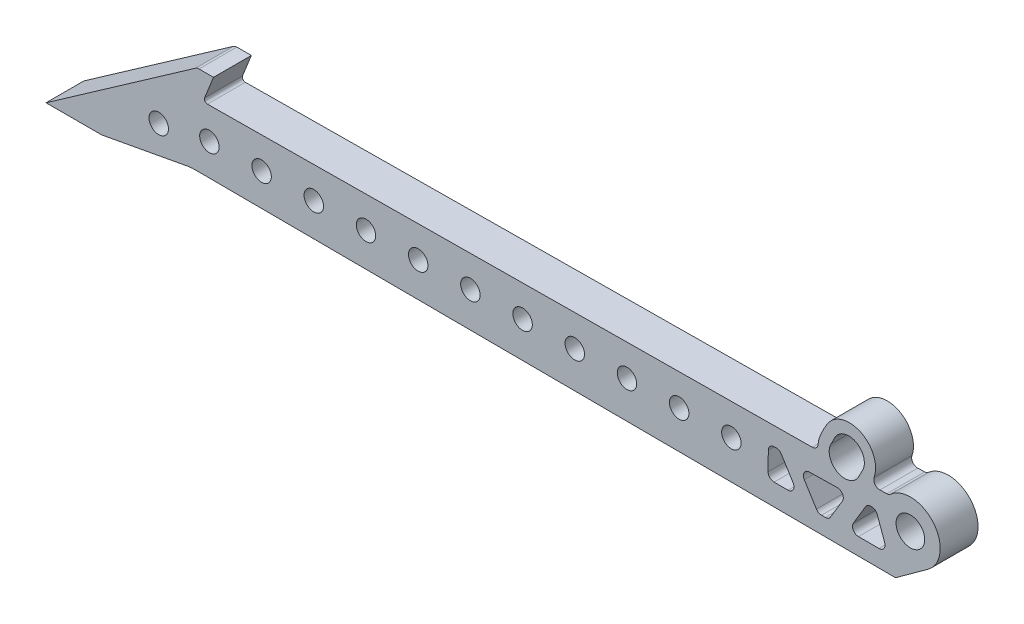
from build123d import *

# Parameters (mm, degrees)
SKETCH1_R           = 3.2639
SKETCH1_R_2         = 4.8025
BOSS_EXTRUDE1_DEPTH = 12.7
EXTRUDE_THIN1_DEPTH = 12.7
FILLET6_R           = 2
FILLET3_R           = 1
FILLET4_R           = 2
BOSS_EXTRUDE5_DEPTH = 12.7
CUT_EXTRUDE8_DEPTH  = 12.7
FILLET13_R          = 100
FILLET14_R          = 2
CUT_EXTRUDE9_DEPTH  = 12.7
FILLET16_R          = 2
BOSS_EXTRUDE6_DEPTH = 12.7
SKETCH18_R          = 3.2639
CUT_EXTRUDE10_DEPTH = 12.7
FILLET17_R          = 2
CUT_EXTRUDE11_DEPTH = 12.7
BOSS_EXTRUDE7_START = -12.7
BOSS_EXTRUDE7_DEPTH = 12.7
DELETEFACE1_DEPTH   = 12.7
MOVE_FACE1_DEPTH    = 12.7
MOVE_FACE1_2_DEPTH  = 12.7
MOVE_FACE2_DEPTH    = 12.7
MOVE_FACE2_2_DEPTH  = 12.7
SKETCH27_R          = 3.2639
CUT_EXTRUDE12_DEPTH = 12.7
FILLET18_R          = 15
FILLET19_R          = 1
FILLET20_R          = 2
MOVE_FACE3_DEPTH    = 12.7
MOVE_FACE3_2_DEPTH  = 12.7
FILLET21_R          = 2


# Read off the part's stored shape, not the designer's step: DeleteFace1, Move Face1, Move Face2, Move Face3
with BuildPart() as part:
    # Sketch1 → Boss-Extrude1 (new body)
    with BuildSketch(Plane.XY):
        with BuildLine():
            Line((-266.801436578, 66.762186411), (-251.101436578, 66.762186411))
            Line((-251.101436578, 66.762186411), (-241.101436578, 68.762186411))
            Line((-241.101436578, 68.762186411), (18.198563422, 71.262186411))
            Line((18.198563422, 71.262186411), (29.067448443, 79.140508783))
            ThreePointArc((29.067448443, 79.140508783), (30.773671377, 93.765412775), (16.057134994, 94.237186411))
            Line((16.057134994, 94.237186411), (-218.528848369, 87.762186411))
            Line((-218.528848369, 87.762186411), (-214.528848369, 97.762186411))
            Line((-214.528848369, 97.762186411), (-222.528848369, 97.762186411))
            Line((-222.528848369, 97.762186411), (-266.801436578, 66.762186411))
        make_face()
        with Locations((-211.801436578, 78.496276476)):
            Circle(SKETCH1_R, mode=Mode.SUBTRACT)
        with BuildLine():
            ThreePointArc((-197.554771535, 78.761405302), (-194.352166872, 82.085470554), (-191.028101621, 78.882865891))
            ThreePointArc((-191.028101621, 78.882865891), (-194.230706283, 75.55880064), (-197.554771535, 78.761405302))
        make_face(mode=Mode.SUBTRACT)
        with BuildLine():
            ThreePointArc((-180.044771535, 79.087264423), (-176.842166872, 82.411329675), (-173.518101621, 79.208725013))
            ThreePointArc((-173.518101621, 79.208725013), (-176.720706283, 75.884659761), (-180.044771535, 79.087264423))
        make_face(mode=Mode.SUBTRACT)
        with BuildLine():
            ThreePointArc((-162.534771535, 79.413123544), (-159.332166872, 82.737188796), (-156.008101621, 79.534584134))
            ThreePointArc((-156.008101621, 79.534584134), (-159.210706283, 76.210518882), (-162.534771535, 79.413123544))
        make_face(mode=Mode.SUBTRACT)
        with BuildLine():
            ThreePointArc((-145.024771535, 79.738982665), (-141.822166872, 83.063047917), (-138.498101621, 79.860443255))
            ThreePointArc((-138.498101621, 79.860443255), (-141.700706283, 76.536378003), (-145.024771535, 79.738982665))
        make_face(mode=Mode.SUBTRACT)
        with Locations((-124.251436578, 80.125572081)):
            Circle(SKETCH1_R, mode=Mode.SUBTRACT)
        with Locations((-106.744467891, 80.45137479)):
            Circle(SKETCH1_R, mode=Mode.SUBTRACT)
        with Locations((-89.237499204, 80.777177499)):
            Circle(SKETCH1_R, mode=Mode.SUBTRACT)
        with Locations((-71.727499204, 81.10303662)):
            Circle(SKETCH1_R, mode=Mode.SUBTRACT)
        with BuildLine():
            ThreePointArc((-56.754762895, 76.539814612), (-61.641816892, 81.290680691), (-56.935012167, 86.220185184))
            Line((-56.935012167, 86.220185184), (11.656299, 88.113430183))
            Line((11.656299, 88.113430183), (15.733532107, 77.238699061))
            Line((15.733532107, 77.238699061), (-56.754762895, 76.539814612))
        make_face(mode=Mode.SUBTRACT)
        with Locations((23.198563422, 87.237186411)):
            Circle(SKETCH1_R_2, mode=Mode.SUBTRACT)
    extrude(amount=BOSS_EXTRUDE1_DEPTH)

    # Sketch3 → Extrude-Thin1 (add)
    with BuildSketch(Plane.XY.offset(12.7)):
        Polygon((4.238515695, 91.06458037), (3.224088624, 89.340939538), (-3.171442721, 78.474116994), (-4.185869793, 76.750476162), (0.554142495, 73.960801716), (1.568569566, 75.684442548), (7.964100911, 86.551265092), (8.978527982, 88.274905924), align=None)
        Polygon((-7.406763076, 76.778305642), (-8.483669151, 78.463616684), (-15.08355213, 88.792145717), (-16.160458205, 90.477456759), (-20.795063569, 87.515965054), (-19.718157494, 85.830654012), (-13.118274515, 75.502124979), (-12.04136844, 73.816813937), align=None)
        Polygon((-55.789995158, 86.920345113), (-54.713089083, 85.235034072), (-48.113206103, 74.906505038), (-47.036300029, 73.221193997), (-42.401694665, 76.182685702), (-43.478600739, 77.867996743), (-50.078483719, 88.196525777), (-51.155389794, 89.881836818), align=None)
        Polygon((-30.756415894, 90.46896043), (-31.770842965, 88.745319598), (-38.16637431, 77.878497054), (-39.180801381, 76.154856222), (-34.440789094, 73.365181776), (-33.426362022, 75.088822608), (-27.030830678, 85.955645152), (-26.016403606, 87.679285984), align=None)
    extrude(amount=-EXTRUDE_THIN1_DEPTH)

    # Fillet6
    fillet6_edges = [part.edges().sort_by_distance(p)[0] for p in [
        (-7.55746183, 77.014142621, 6.35),
        (-14.193924314, 87.399916982, 6.35),
        (-38.852657232, 76.712414937, 6.35),
        (-32.865984778, 86.884534137, 6.35),
        (-32.434398171, 76.774295568, 6.35),
        (-26.378761772, 87.063593296, 6.35),
        (-49.203405679, 76.61261983, 6.35),
        (-55.370195509, 86.263376972, 6.35),
        (-42.716385675, 76.675163409, 6.35),
        (-48.956334512, 86.440411206, 6.35),
        (15.733532107, 77.238699061, 6.35),
        (11.656299, 88.113430183, 6.35),
        (-4.010566108, 77.048339456, 6.35),
        (2.350483264, 87.856572736, 6.35),
        (2.407692953, 77.110220087, 6.35),
        (8.83770627, 88.035631895, 6.35),
    ]]
    fillet(fillet6_edges, radius=FILLET6_R)

    # Fillet3
    fillet3_edges = [part.edges().sort_by_distance(p)[0] for p in [
        (-218.528848369, 87.762186411, 6.35),
    ]]
    fillet(fillet3_edges, radius=FILLET3_R)

    # Fillet4
    fillet4_edges = [part.edges().sort_by_distance(p)[0] for p in [
        (-222.528848369, 97.762186411, 6.35),
    ]]
    fillet(fillet4_edges, radius=FILLET4_R)

    # Sketch15 → Boss-Extrude5 (add)
    with BuildSketch(Plane(origin=(0, 0, 0), x_dir=(-1, 0, 0), z_dir=(0, 0, -1))):
        with BuildLine():
            ThreePointArc((-10.240564525, 95.177858348), (-9.91771052, 94.625214052), (-9.618412164, 94.059465945))
            Line((-9.618412164, 94.059465945), (-5.586658581, 93.948182209))
            ThreePointArc((-5.586658581, 93.948182209), (-6.060393003, 94.847345318), (-6.352002714, 95.820937828))
            ThreePointArc((-6.352002714, 95.820937828), (-4.888389862, 104.071201116), (2.646503395, 100.405905698))
            ThreePointArc((2.646503395, 100.405905698), (3.686135654, 98.752465403), (4.04944042, 96.833426662))
            ThreePointArc((4.04944042, 96.833426662), (3.785365476, 95.18933076), (3.019706577, 93.710630871))
            Line((3.019706577, 93.710630871), (7.309930071, 93.592212896))
            ThreePointArc((7.309930071, 93.592212896), (7.772330748, 96.70964865), (7.106994943, 99.790159701))
            ThreePointArc((7.106994943, 99.790159701), (6.028678087, 102.129209778), (4.770165569, 104.37644558))
            ThreePointArc((4.770165569, 104.37644558), (-7.334493094, 107.282517011), (-10.240564525, 95.177858348))
        make_face()
    extrude(amount=-BOSS_EXTRUDE5_DEPTH)

    # Sketch15<3> → Cut-Extrude8 (cut)
    with BuildSketch(Plane(origin=(0, 0, 0), x_dir=(-1, 0, 0), z_dir=(0, 0, -1))):
        with BuildLine():
            Line((3.019706577, 93.710630871), (-5.586658581, 93.948182209))
            ThreePointArc((-5.586658581, 93.948182209), (-1.345413965, 91.585425404), (3.019706577, 93.710630871))
        make_face()
    extrude(amount=-CUT_EXTRUDE8_DEPTH, mode=Mode.SUBTRACT)

    # Fillet13
    fillet13_edges = [part.edges().sort_by_distance(p)[0] for p in [
        (6.352002714, 95.820937828, 6.35),
        (-2.646503395, 100.405905698, 6.35),
    ]]
    fillet(fillet13_edges, radius=FILLET13_R)

    # Fillet14
    fillet14_edges = [part.edges().sort_by_distance(p)[0] for p in [
        (16.057134994, 94.237186411, 6.35),
        (-7.309930071, 93.592212896, 6.35),
        (9.618412164, 94.059465945, 6.35),
    ]]
    fillet(fillet14_edges, radius=FILLET14_R)

    # Sketch17 → Cut-Extrude9 (cut)
    with BuildSketch(Plane(origin=(0, 0, 0), x_dir=(-1, 0, 0), z_dir=(0, 0, -1))):
        Polygon((225.771163147, 83.894534568), (237.695045428, 75.54534231), (222.695045428, 75.689962442), align=None)
    extrude(amount=-CUT_EXTRUDE9_DEPTH, mode=Mode.SUBTRACT)

    # Fillet16
    fillet16_edges = [part.edges().sort_by_distance(p)[0] for p in [
        (-237.695045428, 75.54534231, 6.35),
        (-225.771163147, 83.894534568, 6.35),
        (-222.695045428, 75.689962442, 6.35),
    ]]
    fillet(fillet16_edges, radius=FILLET16_R)

    # Sketch20 → Boss-Extrude6 (add)
    with BuildSketch(Plane(origin=(0, 0, 0), x_dir=(-1, 0, 0), z_dir=(0, 0, -1))):
        Polygon((24.344481835, 87.119743124), (24.344481835, 76.852293218), (33.994868443, 72.80053303), (65.802348689, 76.852293218), (61.329456715, 89.562181047), align=None)
    extrude(amount=-BOSS_EXTRUDE6_DEPTH)

    # Sketch18 → Cut-Extrude10 (cut)
    with BuildSketch(Plane(origin=(0, 0, 0), x_dir=(-1, 0, 0), z_dir=(0, 0, -1))):
        with Locations((54.220530518, 81.428839328)):
            Circle(SKETCH18_R)
        with Locations((36.713561831, 81.754642037)):
            Circle(SKETCH18_R)
    extrude(amount=-CUT_EXTRUDE10_DEPTH, mode=Mode.SUBTRACT)

    # Fillet17
    fillet17_edges = [part.edges().sort_by_distance(p)[0] for p in [
        (-14.044481835, 76.951599042, 6.35),
        (-20.607785311, 87.222882748, 6.35),
        (-24.344481835, 76.852293218, 6.35),
        (-24.344481835, 87.119743124, 6.35),
    ]]
    fillet(fillet17_edges, radius=FILLET17_R)

    # Sketch21 → Cut-Extrude11 (cut)
    with BuildSketch(Plane(origin=(0, 0, 0), x_dir=(-1, 0, 0), z_dir=(0, 0, -1))):
        Polygon((-18.198563422, 71.262186411), (237.097520463, 68.800789536), (218.101436578, 72.320034463), align=None)
    extrude(amount=-CUT_EXTRUDE11_DEPTH, mode=Mode.SUBTRACT)

    # Sketch23 → Boss-Extrude7 (add)
    with BuildSketch(Plane(origin=(0, 0, 0), x_dir=(-1, 0, 0), z_dir=(0, 0, -1)).offset(BOSS_EXTRUDE7_START)):
        with BuildLine():
            Line((214.132797507, 93.43564849), (7.760879339, 95.236628935))
            ThreePointArc((7.760879339, 95.236628935), (8.411151209, 94.031058955), (9.684666066, 93.526665861))
            Line((9.684666066, 93.526665861), (217.007580476, 87.804176173))
            ThreePointArc((217.007580476, 87.804176173), (217.855425222, 88.231795195), (217.963648478, 89.175186136))
            Line((217.963648478, 89.175186136), (214.528848369, 97.762186411))
            Line((214.528848369, 97.762186411), (221.898250791, 97.762186411))
            ThreePointArc((221.898250791, 97.762186411), (222.49966239, 97.669620312), (223.045403664, 97.400490499))
            Line((223.045403664, 97.400490499), (216.102182338, 102.262186411))
            Line((216.102182338, 102.262186411), (210.602182338, 102.262186411))
            Line((210.602182338, 102.262186411), (214.132797507, 93.43564849))
        make_face()
        Polygon((241.101436578, 68.762186411), (251.101436578, 66.762186411), (248.101436578, 66.762186411), (237.097520463, 68.800789536), align=None)
    extrude(amount=BOSS_EXTRUDE7_DEPTH)

    # DeleteFace1 outline → DeleteFace1 (add)
    with BuildSketch(Plane.XY):
        with BuildLine():
            ThreePointArc((-232.41031363, 79.245751353), (-233.167673391, 76.996847862), (-231.24387897, 75.607540213))
            Line((-231.24387897, 75.607540213), (-225.551208697, 75.662425195))
            ThreePointArc((-225.551208697, 75.662425195), (-223.921202956, 76.531027402), (-223.697787346, 78.364459696))
            Line((-223.697787346, 78.364459696), (-224.86520894, 81.478187952))
            ThreePointArc((-224.86520894, 81.478187952), (-226.145702257, 82.686371348), (-227.88506495, 82.414364591))
            Line((-227.88506495, 82.414364591), (-232.41031363, 79.245751353))
        make_face()
    extrude(amount=DELETEFACE1_DEPTH)

    # Move Face1 outline → Move Face1 (cut)
    with BuildSketch(Plane.XY):
        with BuildLine():
            ThreePointArc((-24.50537332, 79.036329201), (-24.314016139, 78.162656149), (-23.76098511, 77.45974872))
            ThreePointArc((-23.76098511, 77.45974872), (-24.192860388, 78.107799283), (-24.344481835, 78.871668856))
            Line((-24.344481835, 78.871668856), (-24.344481835, 85.174185048))
            ThreePointArc((-24.344481835, 85.174185048), (-23.778072649, 86.568752141), (-22.399664457, 87.173423623))
            Line((-22.399664457, 87.173423623), (-21.73896166, 87.191660222))
            ThreePointArc((-21.73896166, 87.191660222), (-20.831207894, 87.001598932), (-20.106786806, 86.422501117))
            ThreePointArc((-20.106786806, 86.422501117), (-20.845075734, 87.097267125), (-21.817771072, 87.330169438))
            Line((-21.817771072, 87.330169438), (-22.47862181, 87.318462088))
            ThreePointArc((-22.47862181, 87.318462088), (-23.862937429, 86.727440083), (-24.443098586, 85.33853772))
            Line((-24.443098586, 85.33853772), (-24.50537332, 79.036329201))
        make_face()
        with BuildLine():
            ThreePointArc((-8.324891511, 77.952555147), (-7.598664142, 77.263529538), (-6.629502006, 77.012756264))
            Line((-6.629502006, 77.012756264), (-5.321302588, 77.012442231))
            ThreePointArc((-5.321302588, 77.012442231), (-5.126611216, 77.021894012), (-4.933764563, 77.050253049))
            ThreePointArc((-4.933764563, 77.050253049), (-5.037390445, 77.041144937), (-5.141349734, 77.037437184))
            Line((-5.141349734, 77.037437184), (-6.449488392, 77.024824972))
            ThreePointArc((-6.449488392, 77.024824972), (-7.42108109, 77.266009779), (-8.154081221, 77.947825948))
            Line((-8.154081221, 77.947825948), (-12.290602901, 84.421301978))
            ThreePointArc((-12.290602901, 84.421301978), (-12.372491912, 86.434692957), (-10.660474482, 87.497446627))
            Line((-10.660474482, 87.497446627), (-7.587445764, 87.582267811))
            Line((-7.587445764, 87.582267811), (-10.736803264, 87.526475137))
            ThreePointArc((-10.736803264, 87.526475137), (-12.459238114, 86.480689676), (-12.39724728, 84.466587846))
            Line((-12.39724728, 84.466587846), (-8.324891511, 77.952555147))
        make_face()
        with BuildLine():
            ThreePointArc((4.052243065, 80.041189569), (4.024564038, 78.025819476), (5.765296169, 77.0097809))
            Line((5.765296169, 77.0097809), (12.698252915, 77.008116648))
            ThreePointArc((12.698252915, 77.008116648), (13.630682373, 77.238520481), (14.348178535, 77.877042115))
            ThreePointArc((14.348178535, 77.877042115), (13.68295132, 77.389092208), (12.877368838, 77.211161813))
            Line((12.877368838, 77.211161813), (5.944734099, 77.14432191))
            ThreePointArc((5.944734099, 77.14432191), (4.194047538, 78.14311083), (4.201811479, 80.158656033))
            Line((4.201811479, 80.158656033), (7.670211631, 86.051909765))
            Line((7.670211631, 86.051909765), (4.052243065, 80.041189569))
        make_face()
        with BuildLine():
            ThreePointArc((-208.785112786, 79.743206302), (-212.207698907, 83.767453494), (-214.973209883, 79.266274731))
            ThreePointArc((-214.973209883, 79.266274731), (-212.052249394, 81.750525413), (-208.785112786, 79.743206302))
        make_face()
        with BuildLine():
            ThreePointArc((-103.621952617, 81.401607168), (-107.351955287, 84.660576236), (-110.008243114, 80.479914293))
            ThreePointArc((-110.008243114, 80.479914293), (-107.210695338, 83.681804355), (-103.621952617, 81.401607168))
        make_face()
        with BuildLine():
            ThreePointArc((-92.498078721, 80.6299891), (-89.791939616, 83.993641247), (-86.11581505, 81.730136708))
            ThreePointArc((-86.11581505, 81.730136708), (-89.930834979, 84.799412057), (-92.498078721, 80.6299891))
        make_face()
        with BuildLine():
            ThreePointArc((-74.970511489, 80.734370741), (-72.415927954, 84.293508226), (-68.621017286, 82.104442284))
            ThreePointArc((-68.621017286, 82.104442284), (-72.552458321, 84.926248011), (-74.970511489, 80.734370741))
        make_face()
        with BuildLine():
            ThreePointArc((-191.248663435, 80.003056766), (-194.714568399, 83.918741932), (-197.487294238, 79.485111483))
            ThreePointArc((-197.487294238, 79.485111483), (-194.561483882, 82.074844877), (-191.248663435, 80.003056766))
        make_face()
        with BuildLine():
            ThreePointArc((-173.715281989, 80.26680625), (-177.225383788, 84.069562322), (-179.998310688, 79.700049215))
            ThreePointArc((-179.998310688, 79.700049215), (-177.074664267, 82.398696293), (-173.715281989, 80.26680625))
        make_face()
        with BuildLine():
            ThreePointArc((-156.185127552, 80.535804782), (-159.741493142, 84.21969608), (-162.50610013, 79.9097379))
            ThreePointArc((-162.50610013, 79.9097379), (-159.593138616, 82.721861076), (-156.185127552, 80.535804782))
        make_face()
        with BuildLine():
            ThreePointArc((-138.658513403, 80.812091832), (-142.264934226, 84.368778203), (-145.010349283, 80.112138066))
            ThreePointArc((-145.010349283, 80.112138066), (-142.118944696, 83.043974225), (-138.658513403, 80.812091832))
        make_face()
        with BuildLine():
            ThreePointArc((-121.136042829, 81.098898849), (-124.798937068, 84.516160777), (-127.510454861, 80.304018265))
            ThreePointArc((-127.510454861, 80.304018265), (-124.655312534, 83.364387825), (-121.136042829, 81.098898849))
        make_face()
        with BuildLine():
            ThreePointArc((-39.741602066, 80.536440271), (-38.076726294, 84.720249202), (-33.81732279, 83.259581446))
            ThreePointArc((-33.81732279, 83.259581446), (-38.208527488, 85.006986845), (-39.741602066, 80.536440271))
        make_face()
        with BuildLine():
            ThreePointArc((-57.412375767, 80.746807718), (-55.134895592, 84.562045309), (-51.162851049, 82.570609653))
            ThreePointArc((-51.162851049, 82.570609653), (-55.269061372, 85.021784024), (-57.412375767, 80.746807718))
        make_face()
    extrude(amount=MOVE_FACE1_DEPTH, mode=Mode.SUBTRACT)

    # Move Face1 2 outline → Move Face1 2 (add)
    with BuildSketch(Plane.XY):
        with BuildLine():
            Line((-17.834875183, 77.015446106), (-22.505951054, 77.016567395))
            ThreePointArc((-22.505951054, 77.016567395), (-23.171416008, 77.13069428), (-23.76098511, 77.45974872))
            ThreePointArc((-23.76098511, 77.45974872), (-23.102432443, 77.020855285), (-22.325200047, 76.871761805))
            Line((-22.325200047, 76.871761805), (-17.654341127, 76.916795154))
            ThreePointArc((-17.654341127, 76.916795154), (-15.914900671, 77.964391295), (-15.988311874, 79.993608279))
            Line((-15.988311874, 79.993608279), (-19.998467996, 86.269327722))
            ThreePointArc((-19.998467996, 86.269327722), (-20.050830421, 86.34718518), (-20.106786806, 86.422501117))
            ThreePointArc((-20.106786806, 86.422501117), (-20.096556278, 86.406640609), (-20.086475879, 86.390684265))
            Line((-20.086475879, 86.390684265), (-16.13852548, 80.075647108))
            ThreePointArc((-16.13852548, 80.075647108), (-16.085168416, 78.045803814), (-17.834875183, 77.015446106))
        make_face()
        with BuildLine():
            ThreePointArc((-3.607289287, 77.981033446), (-4.172036691, 77.375282685), (-4.933764563, 77.050253049))
            ThreePointArc((-4.933764563, 77.050253049), (-4.070842996, 77.360334703), (-3.436990691, 78.022917164))
            Line((-3.436990691, 78.022917164), (0.51816646, 84.743233048))
            ThreePointArc((0.51816646, 84.743233048), (0.516873837, 86.774280326), (-1.260656995, 87.756898694))
            Line((-1.260656995, 87.756898694), (-7.587445764, 87.582267811))
            Line((-7.587445764, 87.582267811), (-1.334881025, 87.693035582))
            ThreePointArc((-1.334881025, 87.693035582), (0.432853847, 86.692901522), (0.414077766, 84.661940622))
            Line((0.414077766, 84.661940622), (-3.607289287, 77.981033446))
        make_face()
        with BuildLine():
            ThreePointArc((14.578282404, 79.691705712), (14.682845476, 78.756526183), (14.348178535, 77.877042115))
            ThreePointArc((14.348178535, 77.877042115), (14.823685661, 78.84171524), (14.730790188, 79.913196315))
            Line((14.730790188, 79.913196315), (12.157386783, 86.776936838))
            ThreePointArc((12.157386783, 86.776936838), (11.401137641, 87.734185921), (10.229501023, 88.074047963))
            Line((10.229501023, 88.074047963), (9.944546379, 88.066182696))
            ThreePointArc((9.944546379, 88.066182696), (8.983108795, 87.789292331), (8.27608817, 87.081371193))
            Line((8.27608817, 87.081371193), (7.670211631, 86.051909765))
            Line((7.670211631, 86.051909765), (8.194723737, 86.923309129))
            ThreePointArc((8.194723737, 86.923309129), (8.908704768, 87.624209685), (9.872831352, 87.891586634))
            Line((9.872831352, 87.891586634), (10.1578498, 87.896635899))
            ThreePointArc((10.1578498, 87.896635899), (11.326071068, 87.545213586), (12.07282478, 86.580538788))
            Line((12.07282478, 86.580538788), (14.578282404, 79.691705712))
        make_face()
        with BuildLine():
            ThreePointArc((-208.785112786, 79.743206302), (-211.706073275, 77.25895562), (-214.973209883, 79.266274731))
            ThreePointArc((-214.973209883, 79.266274731), (-211.550623762, 75.242027539), (-208.785112786, 79.743206302))
        make_face()
        with BuildLine():
            ThreePointArc((-103.621952617, 81.401607168), (-106.419500393, 78.199717106), (-110.008243114, 80.479914293))
            ThreePointArc((-110.008243114, 80.479914293), (-106.278240444, 77.220945225), (-103.621952617, 81.401607168))
        make_face()
        with BuildLine():
            ThreePointArc((-86.11581505, 81.730136708), (-88.821954155, 78.366484561), (-92.498078721, 80.6299891))
            ThreePointArc((-92.498078721, 80.6299891), (-88.683058792, 77.560713751), (-86.11581505, 81.730136708))
        make_face()
        with BuildLine():
            ThreePointArc((-68.621017286, 82.104442284), (-71.175600821, 78.545304799), (-74.970511489, 80.734370741))
            ThreePointArc((-74.970511489, 80.734370741), (-71.039070454, 77.912565014), (-68.621017286, 82.104442284))
        make_face()
        with BuildLine():
            ThreePointArc((-191.248663435, 80.003056766), (-194.174473791, 77.413323372), (-197.487294238, 79.485111483))
            ThreePointArc((-197.487294238, 79.485111483), (-194.021389274, 75.569426317), (-191.248663435, 80.003056766))
        make_face()
        with BuildLine():
            ThreePointArc((-173.715281989, 80.26680625), (-176.63892841, 77.568159172), (-179.998310688, 79.700049215))
            ThreePointArc((-179.998310688, 79.700049215), (-176.488208889, 75.897293143), (-173.715281989, 80.26680625))
        make_face()
        with BuildLine():
            ThreePointArc((-156.185127552, 80.535804782), (-159.098089066, 77.723681606), (-162.50610013, 79.9097379))
            ThreePointArc((-162.50610013, 79.9097379), (-158.94973454, 76.225846602), (-156.185127552, 80.535804782))
        make_face()
        with BuildLine():
            ThreePointArc((-138.658513403, 80.812091832), (-141.54991799, 77.880255673), (-145.010349283, 80.112138066))
            ThreePointArc((-145.010349283, 80.112138066), (-141.40392846, 76.555451695), (-138.658513403, 80.812091832))
        make_face()
        with BuildLine():
            ThreePointArc((-121.136042829, 81.098898849), (-123.991185156, 78.038529289), (-127.510454861, 80.304018265))
            ThreePointArc((-127.510454861, 80.304018265), (-123.847560622, 76.886756337), (-121.136042829, 81.098898849))
        make_face()
        with BuildLine():
            ThreePointArc((-33.81732279, 83.259581446), (-35.482198562, 79.075772515), (-39.741602066, 80.536440271))
            ThreePointArc((-39.741602066, 80.536440271), (-35.350397368, 78.789034872), (-33.81732279, 83.259581446))
        make_face()
        with BuildLine():
            ThreePointArc((-51.162851049, 82.570609653), (-53.440331224, 78.755372062), (-57.412375767, 80.746807718))
            ThreePointArc((-57.412375767, 80.746807718), (-53.306165444, 78.295633347), (-51.162851049, 82.570609653))
        make_face()
    extrude(amount=MOVE_FACE1_2_DEPTH)

    # Move Face2 outline → Move Face2 (cut)
    with BuildSketch(Plane.XY):
        with BuildLine():
            ThreePointArc((-24.52640427, 81.446237436), (-24.517255088, 81.234377245), (-24.485725635, 81.024676646))
            Line((-24.485725635, 81.024676646), (-24.443098586, 85.33853772))
            ThreePointArc((-24.443098586, 85.33853772), (-23.862937429, 86.727440083), (-22.47862181, 87.318462088))
            Line((-22.47862181, 87.318462088), (-21.817771072, 87.330169438))
            ThreePointArc((-21.817771072, 87.330169438), (-20.828444713, 87.088343644), (-20.086475879, 86.390684265))
            Line((-20.086475879, 86.390684265), (-16.242777815, 80.242406389))
            ThreePointArc((-16.242777815, 80.242406389), (-15.856801043, 81.351204798), (-16.15955643, 82.485555342))
            Line((-16.15955643, 82.485555342), (-20.10750683, 88.800592499))
            ThreePointArc((-20.10750683, 88.800592499), (-20.849475663, 89.498251878), (-21.838802022, 89.740077673))
            Line((-21.838802022, 89.740077673), (-22.499652761, 89.728370323))
            ThreePointArc((-22.499652761, 89.728370323), (-23.88396838, 89.137348317), (-24.464129537, 87.748445954))
            Line((-24.464129537, 87.748445954), (-24.52640427, 81.446237436))
        make_face()
        with BuildLine():
            ThreePointArc((-208.934199045, 81.744629031), (-212.006399579, 86.186888512), (-215.000604087, 81.691688317))
            ThreePointArc((-215.000604087, 81.691688317), (-211.985368629, 83.776980278), (-208.934199045, 81.744629031))
        make_face()
        with BuildLine():
            ThreePointArc((-103.863040795, 82.661571145), (-106.935241328, 87.103830627), (-109.929445835, 82.608630432))
            ThreePointArc((-109.929445835, 82.608630432), (-106.914210378, 84.693922392), (-103.863040795, 82.661571145))
        make_face()
        with BuildLine():
            ThreePointArc((-86.353707522, 82.814372783), (-89.425908055, 87.256632265), (-92.420112562, 82.76143207))
            ThreePointArc((-92.420112562, 82.76143207), (-89.404877105, 84.84672403), (-86.353707522, 82.814372783))
        make_face()
        with BuildLine():
            ThreePointArc((-68.841342526, 82.96720088), (-71.913543062, 87.40946036), (-74.907747567, 82.914260164))
            ThreePointArc((-74.907747567, 82.914260164), (-71.892512111, 84.999552126), (-68.841342526, 82.96720088))
        make_face()
        with BuildLine():
            ThreePointArc((-191.42183405, 81.897457126), (-194.494034583, 86.339716608), (-197.48823909, 81.844516413))
            ThreePointArc((-197.48823909, 81.844516413), (-194.473003633, 83.929808373), (-191.42183405, 81.897457126))
        make_face()
        with BuildLine():
            ThreePointArc((-173.909469054, 82.050285222), (-176.98166959, 86.492544703), (-179.975874095, 81.997344507))
            ThreePointArc((-179.975874095, 81.997344507), (-176.960638639, 84.082636468), (-173.909469054, 82.050285222))
        make_face()
        with BuildLine():
            ThreePointArc((-156.397104058, 82.203113317), (-159.469304592, 86.645372798), (-162.4635091, 82.150172603))
            ThreePointArc((-162.4635091, 82.150172603), (-159.448273642, 84.235464564), (-156.397104058, 82.203113317))
        make_face()
        with BuildLine():
            ThreePointArc((-138.884739063, 82.355941413), (-141.956939599, 86.798200894), (-144.951144104, 82.303000698))
            ThreePointArc((-144.951144104, 82.303000698), (-141.935908648, 84.388292659), (-138.884739063, 82.355941413))
        make_face()
        with BuildLine():
            ThreePointArc((-121.372374067, 82.508769508), (-124.444574603, 86.951028989), (-127.438779108, 82.455828793))
            ThreePointArc((-127.438779108, 82.455828793), (-124.423543652, 84.541120754), (-121.372374067, 82.508769508))
        make_face()
        with BuildLine():
            ThreePointArc((-33.82267598, 83.272804155), (-36.894876516, 87.715063636), (-39.889081021, 83.21986344))
            ThreePointArc((-39.889081021, 83.21986344), (-36.873845565, 85.305155401), (-33.82267598, 83.272804155))
        make_face()
        with BuildLine():
            ThreePointArc((-51.332009253, 83.120002518), (-54.404209789, 87.562261998), (-57.398414294, 83.067061802))
            ThreePointArc((-57.398414294, 83.067061802), (-54.383178838, 85.152353764), (-51.332009253, 83.120002518))
        make_face()
    extrude(amount=MOVE_FACE2_DEPTH, mode=Mode.SUBTRACT)

    # Move Face2 2 outline → Move Face2 2 (add)
    with BuildSketch(Plane.XY):
        with BuildLine():
            Line((-17.855906133, 79.425354341), (-22.526982004, 79.42647563))
            ThreePointArc((-22.526982004, 79.42647563), (-23.790887683, 79.876853488), (-24.485725635, 81.024676646))
            Line((-24.485725635, 81.024676646), (-24.50537332, 79.036329201))
            ThreePointArc((-24.50537332, 79.036329201), (-23.926823107, 77.609528581), (-22.505951054, 77.016567395))
            Line((-22.505951054, 77.016567395), (-17.834875183, 77.015446106))
            ThreePointArc((-17.834875183, 77.015446106), (-16.085168416, 78.045803814), (-16.13852548, 80.075647108))
            Line((-16.13852548, 80.075647108), (-16.242777815, 80.242406389))
            ThreePointArc((-16.242777815, 80.242406389), (-16.951730829, 79.641163997), (-17.855906133, 79.425354341))
        make_face()
        with BuildLine():
            ThreePointArc((-208.934199045, 81.744629031), (-211.949434503, 79.65933707), (-215.000604087, 81.691688317))
            ThreePointArc((-215.000604087, 81.691688317), (-211.928403553, 77.249428836), (-208.934199045, 81.744629031))
        make_face()
        with BuildLine():
            ThreePointArc((-103.863040795, 82.661571145), (-106.878276252, 80.576279185), (-109.929445835, 82.608630432))
            ThreePointArc((-109.929445835, 82.608630432), (-106.857245302, 78.16637095), (-103.863040795, 82.661571145))
        make_face()
        with BuildLine():
            ThreePointArc((-86.353707522, 82.814372783), (-89.368942979, 80.729080823), (-92.420112562, 82.76143207))
            ThreePointArc((-92.420112562, 82.76143207), (-89.347912029, 78.319172588), (-86.353707522, 82.814372783))
        make_face()
        with BuildLine():
            ThreePointArc((-68.841342526, 82.96720088), (-71.856577982, 80.881908918), (-74.907747567, 82.914260164))
            ThreePointArc((-74.907747567, 82.914260164), (-71.835547031, 78.472000684), (-68.841342526, 82.96720088))
        make_face()
        with BuildLine():
            ThreePointArc((-191.42183405, 81.897457126), (-194.437069507, 79.812165166), (-197.48823909, 81.844516413))
            ThreePointArc((-197.48823909, 81.844516413), (-194.416038557, 77.402256931), (-191.42183405, 81.897457126))
        make_face()
        with BuildLine():
            ThreePointArc((-173.909469054, 82.050285222), (-176.92470451, 79.964993261), (-179.975874095, 81.997344507))
            ThreePointArc((-179.975874095, 81.997344507), (-176.903673559, 77.555085026), (-173.909469054, 82.050285222))
        make_face()
        with BuildLine():
            ThreePointArc((-156.397104058, 82.203113317), (-159.412339516, 80.117821356), (-162.4635091, 82.150172603))
            ThreePointArc((-162.4635091, 82.150172603), (-159.391308566, 77.707913122), (-156.397104058, 82.203113317))
        make_face()
        with BuildLine():
            ThreePointArc((-138.884739063, 82.355941413), (-141.899974519, 80.270649452), (-144.951144104, 82.303000698))
            ThreePointArc((-144.951144104, 82.303000698), (-141.878943568, 77.860741217), (-138.884739063, 82.355941413))
        make_face()
        with BuildLine():
            ThreePointArc((-121.372374067, 82.508769508), (-124.387609523, 80.423477547), (-127.438779108, 82.455828793))
            ThreePointArc((-127.438779108, 82.455828793), (-124.366578572, 78.013569312), (-121.372374067, 82.508769508))
        make_face()
        with BuildLine():
            ThreePointArc((-33.82267598, 83.272804155), (-36.837911436, 81.187512194), (-39.889081021, 83.21986344))
            ThreePointArc((-39.889081021, 83.21986344), (-36.816880485, 78.777603959), (-33.82267598, 83.272804155))
        make_face()
        with BuildLine():
            ThreePointArc((-51.332009253, 83.120002518), (-54.347244709, 81.034710556), (-57.398414294, 83.067061802))
            ThreePointArc((-57.398414294, 83.067061802), (-54.326213758, 78.624802322), (-51.332009253, 83.120002518))
        make_face()
    extrude(amount=MOVE_FACE2_2_DEPTH)

    # Sketch27 → Cut-Extrude12 (cut)
    with BuildSketch(Plane(origin=(0, 0, 0), x_dir=(-1, 0, 0), z_dir=(0, 0, -1))):
        with Locations((228.977917041, 79.673112791)):
            Circle(SKETCH27_R)
    extrude(amount=-CUT_EXTRUDE12_DEPTH, mode=Mode.SUBTRACT)

    # Fillet18
    fillet18_edges = [part.edges().sort_by_distance(p)[0] for p in [
        (-218.101436578, 72.320034463, 6.35),
    ]]
    fillet(fillet18_edges, radius=FILLET18_R)

    # Fillet19
    fillet19_edges = [part.edges().sort_by_distance(p)[0] for p in [
        (-214.132797507, 93.43564849, 6.35),
    ]]
    fillet(fillet19_edges, radius=FILLET19_R)

    # Fillet20
    fillet20_edges = [part.edges().sort_by_distance(p)[0] for p in [
        (-216.102182338, 102.262186411, 6.35),
    ]]
    fillet(fillet20_edges, radius=FILLET20_R)

    # Move Face3 outline → Move Face3 (cut)
    with BuildSketch(Plane.XY):
        with BuildLine():
            ThreePointArc((-24.533814969, 80.696274049), (-23.955264756, 79.269473429), (-22.534392703, 78.676512243))
            Line((-22.534392703, 78.676512243), (-17.863316832, 78.675390954))
            ThreePointArc((-17.863316832, 78.675390954), (-16.328203926, 79.39285351), (-15.894698081, 81.03096121))
            ThreePointArc((-15.894698081, 81.03096121), (-16.588486309, 79.877819555), (-17.855906133, 79.425354341))
            Line((-17.855906133, 79.425354341), (-22.526982004, 79.42647563))
            ThreePointArc((-22.526982004, 79.42647563), (-23.947854057, 80.019436816), (-24.52640427, 81.446237436))
            Line((-24.52640427, 81.446237436), (-24.533814969, 80.696274049))
        make_face()
    extrude(amount=MOVE_FACE3_DEPTH, mode=Mode.SUBTRACT)

    # Move Face3 2 outline → Move Face3 2 (add)
    with BuildSketch(Plane.XY):
        with BuildLine():
            ThreePointArc((-16.166967129, 81.735591955), (-15.997263029, 81.396247854), (-15.894698081, 81.03096121))
            ThreePointArc((-15.894698081, 81.03096121), (-15.887778341, 81.783631487), (-16.15955643, 82.485555342))
            Line((-16.15955643, 82.485555342), (-20.10750683, 88.800592499))
            ThreePointArc((-20.10750683, 88.800592499), (-20.849475663, 89.498251878), (-21.838802022, 89.740077673))
            Line((-21.838802022, 89.740077673), (-22.499652761, 89.728370323))
            ThreePointArc((-22.499652761, 89.728370323), (-23.88396838, 89.137348317), (-24.464129537, 87.748445954))
            Line((-24.464129537, 87.748445954), (-24.471540236, 86.998482568))
            ThreePointArc((-24.471540236, 86.998482568), (-23.891379078, 88.387384931), (-22.507063459, 88.978406936))
            Line((-22.507063459, 88.978406936), (-21.846212721, 88.990114286))
            ThreePointArc((-21.846212721, 88.990114286), (-20.856886362, 88.748288492), (-20.114917528, 88.050629113))
            Line((-20.114917528, 88.050629113), (-16.166967129, 81.735591955))
        make_face()
    extrude(amount=MOVE_FACE3_2_DEPTH)

    # Fillet21
    fillet21_edges = [part.edges().sort_by_distance(p)[0] for p in [
        (-7.760879339, 95.236628935, 6.35),
    ]]
    fillet(fillet21_edges, radius=FILLET21_R)


solid = part.part
